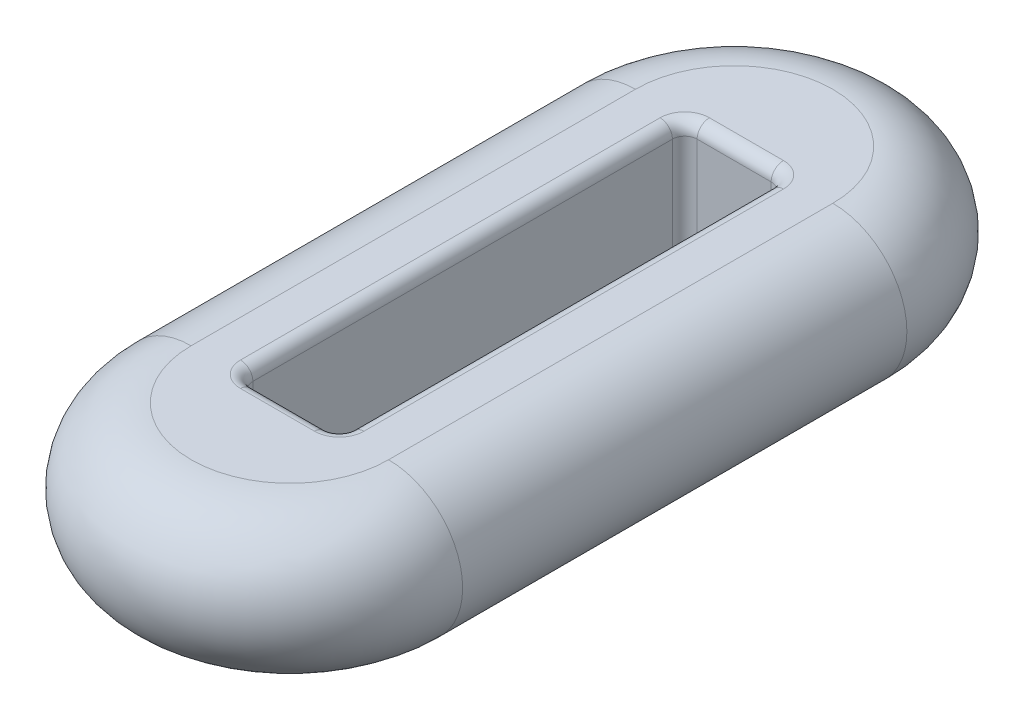
from build123d import *

# Parameters (mm, degrees)
SKETCH1_W      = 7
SKETCH1_H      = 16
SKETCH1_W_2    = 2
SKETCH1_H_2    = 9
EXTRUDE1_DEPTH = 1.5
FILLET1_RADIUS = 3.5
FILLET1_LENGTH = 3
FILLET5_RADIUS = 3.5
FILLET5_LENGTH = 3
FILLET3_R      = 0.25
FILLET4_R      = 0.25
FILLET6_R      = 1.5


with BuildPart() as part:
    # Sketch1 → Extrude1 (new, symmetric)
    with BuildSketch(Plane(origin=(0, 0, 0), x_dir=(1, 0, 0), z_dir=(0, 1, 0))):
        Rectangle(SKETCH1_W, SKETCH1_H)
        Rectangle(SKETCH1_W_2, SKETCH1_H_2, mode=Mode.SUBTRACT)
    extrude(amount=EXTRUDE1_DEPTH, both=True)

    # Fillet1: full round fillet: the end face becomes a half cylinder, R = half its width
    fillet1_face = Plane((0, 0, 8), x_dir=(0, 1, 0), z_dir=(0, 0, 1))  # on the end face: x along it, z out of the body
    fillet1_slab = fillet1_face.offset(-FILLET1_RADIUS / 2) * Box(FILLET1_LENGTH, 2 * FILLET1_RADIUS, FILLET1_RADIUS, mode=Mode.PRIVATE)  # the body's end, R deep
    fillet1_round = Plane((0, 0, 4.5), x_dir=(0, 0, 1), z_dir=(0, 1, 0)) * Cylinder(FILLET1_RADIUS, FILLET1_LENGTH, mode=Mode.PRIVATE)  # its axis R under the face
    add(fillet1_slab - fillet1_round, mode=Mode.SUBTRACT)

    # Fillet5: full round fillet: the end face becomes a half cylinder, R = half its width
    fillet5_face = Plane((0, 0, -8), x_dir=(0, 1, 0), z_dir=(0, 0, -1))  # on the end face: x along it, z out of the body
    fillet5_slab = fillet5_face.offset(-FILLET5_RADIUS / 2) * Box(FILLET5_LENGTH, 2 * FILLET5_RADIUS, FILLET5_RADIUS, mode=Mode.PRIVATE)  # the body's end, R deep
    fillet5_round = Plane((0, 0, -4.5), x_dir=(0, 0, -1), z_dir=(0, 1, 0)) * Cylinder(FILLET5_RADIUS, FILLET5_LENGTH, mode=Mode.PRIVATE)  # its axis R under the face
    add(fillet5_slab - fillet5_round, mode=Mode.SUBTRACT)

    # Fillet3
    fillet3_edges = [part.edges().sort_by_distance(p)[0] for p in [
        (-1, 0, -4.5),
        (-1, 0, 4.5),
        (1, 0, 4.5),
        (1, 0, -4.5),
    ]]
    fillet(fillet3_edges, radius=FILLET3_R)

    # Fillet4
    fillet4_edges = [part.edges().sort_by_distance(p)[0] for p in [
        (1, -1.5, 0),
        (1, 1.5, 0),
        (0, -1.5, -4.5),
        (0, 1.5, -4.5),
        (-1, -1.5, 0),
        (-1, 1.5, 0),
        (0, -1.5, 4.5),
        (0, 1.5, 4.5),
        (0.926776695, -1.5, -4.426776695),
        (0.926776695, 1.5, -4.426776695),
        (-0.926776695, -1.5, -4.426776695),
        (-0.926776695, 1.5, -4.426776695),
        (0.926776695, -1.5, 4.426776695),
        (0.926776695, 1.5, 4.426776695),
        (-0.926776695, -1.5, 4.426776695),
        (-0.926776695, 1.5, 4.426776695),
    ]]
    fillet(fillet4_edges, radius=FILLET4_R)

    # Fillet6
    fillet6_edges = [part.edges().sort_by_distance(p)[0] for p in [
        (3.5, -1.5, 0),
        (3.5, 1.5, 0),
        (0, 1.5, 8),
        (-3.5, -1.5, 0),
        (-3.5, 1.5, 0),
        (0, -1.5, -8),
    ]]
    fillet(fillet6_edges, radius=FILLET6_R - 0.0001)  # a hair under: the kernel refuses the full size


solid = part.part
